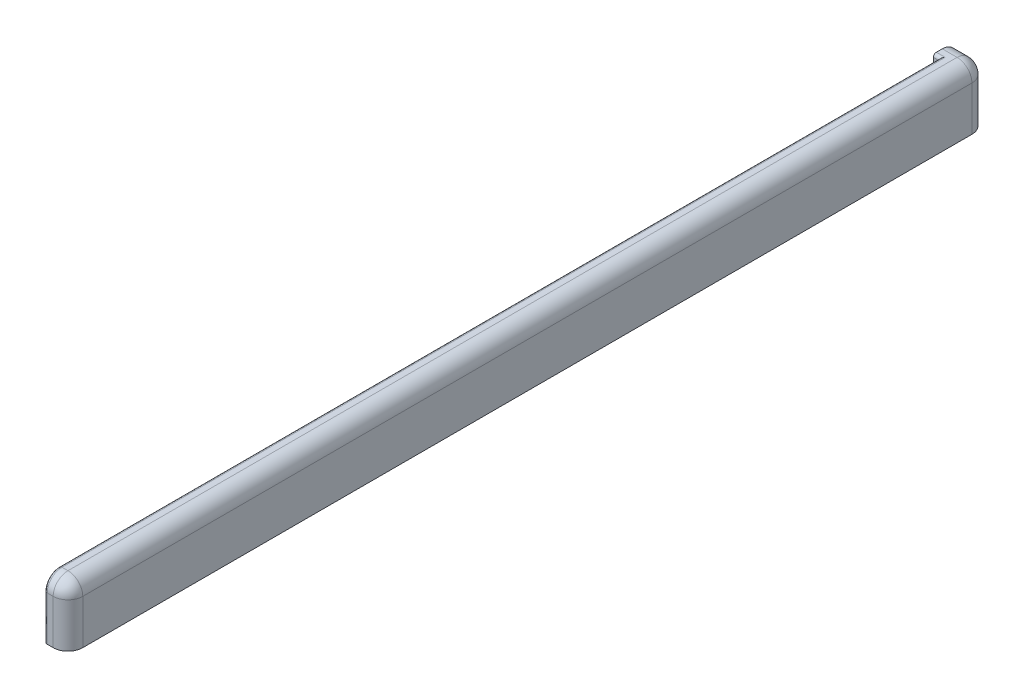
from build123d import *

# Parameters (mm, degrees)
SKETCH1_W                       = 39
SKETCH1_H                       = 155
BOSS_EXTRUDE1_DEPTH             = 2
BOSS_EXTRUDE2_DEPTH             = 38
SKETCH3_W                       = 2
SKETCH3_H                       = 2
BOSS_EXTRUDE3_DEPTH             = 38
SKETCH4_W                       = 2
SKETCH4_H                       = 2
BOSS_EXTRUDE4_DEPTH             = 151
SKETCH6_W                       = 35
SKETCH6_H                       = 2.2
CUT_EXTRUDE1_DEPTH              = 160.340045186
SKETCH7_W                       = 35
SKETCH7_H                       = 2.2
CUT_EXTRUDE2_DEPTH              = 89.490112442
SKETCH5_W                       = 31
SKETCH5_H                       = 2
BOSS_EXTRUDE5_DEPTH             = 2
BOSS_EXTRUDE6_REACH             = 91.367
SKETCH8_W                       = 2
SKETCH8_H                       = 2
BOSS_EXTRUDE6_DIRECTION_2_REACH = 91.367
SKETCH10_W                      = 2
SKETCH10_H                      = 2.2
SKETCH10_W_2                    = 2.2
SKETCH10_H_2                    = 2
BOSS_EXTRUDE8_DEPTH             = 2
SKETCH11_W                      = 2
SKETCH11_H                      = 2.2
SKETCH11_W_2                    = 2.2
SKETCH11_H_2                    = 2
BOSS_EXTRUDE9_DEPTH             = 2
FILLET2_R                       = 2.5
SKETCH14_W                      = 36.5
SKETCH14_H                      = 7.75
BOSS_EXTRUDE10_DEPTH            = 2
SKETCH13_W                      = 31
SKETCH13_H                      = 3
CUT_EXTRUDE4_DEPTH              = 2
FILLET3_R                       = 2
FILLET4_R                       = 0.5
SKETCH15_R                      = 5.1
CUT_EXTRUDE5_DEPTH              = 90.367219941
SKETCH16_R                      = 7.1
BOSS_EXTRUDE11_DEPTH            = 1
FILLET5_R                       = 0.5
CUT_EXTRUDE3_DEPTH              = 160.340045186
FILLET6_R                       = 0.4
FILLET7_R                       = 0.5
CUT_EXTRUDE6_DEPTH              = 6
SKETCH18_W                      = 29
SKETCH18_H                      = 3
CUT_EXTRUDE8_DEPTH              = 90.367220028
CUT_EXTRUDE11_DEPTH             = 90.367220028
CUT_EXTRUDE11_DEPTH_BACK        = 90.367220028
SKETCH20_W                      = 29
SKETCH20_H                      = 34
SKETCH21_W                      = 155
SKETCH21_H                      = 20
SKETCH21_H_2                    = 10
CUT_EXTRUDE12_DEPTH             = 90.367219941


with BuildPart() as part:
    # Sketch1 → Boss-Extrude1 (new body)
    with BuildSketch(Plane(origin=(0, 0, 0), x_dir=(1, 0, 0), z_dir=(0, 1, 0))):
        Rectangle(SKETCH1_W, SKETCH1_H)
    extrude(amount=BOSS_EXTRUDE1_DEPTH)

    # Sketch2 → Boss-Extrude2 (add)
    with BuildSketch(Plane(origin=(0, 2, 0), x_dir=(1, 0, 0), z_dir=(0, 1, 0))):
        Polygon((-17.5, -77.5), (-17.5, -75.5), (-17.5, 75.5), (17.5, 75.5), (17.5, -75.5), (17.5, -77.5), (19.5, -77.5), (19.5, 77.5), (-19.5, 77.5), (-19.5, -77.5), align=None)
    extrude(amount=BOSS_EXTRUDE2_DEPTH)

    # Sketch3 → Boss-Extrude3 (add)
    with BuildSketch(Plane(origin=(0, 2, 0), x_dir=(1, 0, 0), z_dir=(0, 1, 0))):
        with Locations((-16.5, -76.5)):
            Rectangle(SKETCH3_W, SKETCH3_H)
        with Locations((-16.5, -72.3)):
            Rectangle(SKETCH3_W, SKETCH3_H)
        with Locations((16.5, -76.5)):
            Rectangle(SKETCH3_W, SKETCH3_H)
        with Locations((16.5, -72.3)):
            Rectangle(SKETCH3_W, SKETCH3_H)
    extrude(amount=BOSS_EXTRUDE3_DEPTH)

    # Sketch4 → Boss-Extrude4 (add)
    with BuildSketch(Plane.XY.offset(-75.5)):
        with Locations((-16.5, 39)):
            Rectangle(SKETCH4_W, SKETCH4_H)
        Polygon((-15.5, 33.8), (-17.5, 31.8), (-17.5, 35.8), (-15.5, 35.8), align=None)
        Polygon((15.5, 35.8), (17.5, 35.8), (17.5, 31.8), (15.5, 33.8), align=None)
        with Locations((16.5, 39)):
            Rectangle(SKETCH4_W, SKETCH4_H)
    extrude(amount=BOSS_EXTRUDE4_DEPTH)

    # Sketch6 → Cut-Extrude1 (cut, through all)
    with BuildSketch(Plane.XY.offset(-75.5)):
        with Locations((0, 36.9)):
            Rectangle(SKETCH6_W, SKETCH6_H)
    extrude(amount=CUT_EXTRUDE1_DEPTH, mode=Mode.SUBTRACT)

    # Sketch7 → Cut-Extrude2 (cut, through all)
    with BuildSketch(Plane(origin=(0, 2, 0), x_dir=(1, 0, 0), z_dir=(0, 1, 0))):
        with Locations((0, -74.4)):
            Rectangle(SKETCH7_W, SKETCH7_H)
    extrude(amount=CUT_EXTRUDE2_DEPTH, mode=Mode.SUBTRACT)

    # Sketch5 → Boss-Extrude5 (add)
    with BuildSketch(Plane(origin=(0, 2, 0), x_dir=(1, 0, 0), z_dir=(0, 1, 0))):
        with Locations((0, -76.5)):
            Rectangle(SKETCH5_W, SKETCH5_H)
        with Locations((0, -72.3)):
            Rectangle(SKETCH5_W, SKETCH5_H)
    extrude(amount=BOSS_EXTRUDE5_DEPTH)

    # Boss-Extrude6: up to this face of the body (flat: up to its plane)
    boss_extrude6_end = Plane(part.part.faces().sort_by_distance((17.5, 16.9, -2.1))[0])
    # Sketch8 → Boss-Extrude6 (add, up to the picked face)
    with BuildSketch(Plane(origin=(0, 0, 0), x_dir=(0, 0, -1), z_dir=(1, 0, 0)), mode=Mode.PRIVATE) as boss_extrude6_sk1:
        with Locations((74.5, 39)):
            Rectangle(SKETCH8_W, SKETCH8_H)
    boss_extrude6_tool1 = split(extrude(boss_extrude6_sk1.sketch, amount=BOSS_EXTRUDE6_REACH, mode=Mode.PRIVATE), bisect_by=boss_extrude6_end, keep=Keep.BOTH, mode=Mode.PRIVATE)
    # Sketch8 → Boss-Extrude6 (add, up to the picked face)
    with BuildSketch(Plane(origin=(0, 0, 0), x_dir=(0, 0, -1), z_dir=(1, 0, 0)), mode=Mode.PRIVATE) as boss_extrude6_sk2:
        Polygon((75.5, 35.8), (73.5, 35.8), (73.5, 33.8), (75.5, 31.8), align=None)
    boss_extrude6_tool2 = split(extrude(boss_extrude6_sk2.sketch, amount=BOSS_EXTRUDE6_REACH, mode=Mode.PRIVATE), bisect_by=boss_extrude6_end, keep=Keep.BOTH, mode=Mode.PRIVATE)
    add(boss_extrude6_tool1.solids().sort_by(Axis((0, 39, -74.5), (1, 0, 0)))[0])
    add(boss_extrude6_tool2.solids().sort_by(Axis((0, 34.244444, -74.611111), (1, 0, 0)))[0])

    # Boss-Extrude6 direction 2: up to this face of the body (flat: up to its plane)
    boss_extrude6_direction_2_end = Plane(part.part.faces().sort_by_distance((-17.5, 16.9, -2.1))[0])
    # Sketch8 → Boss-Extrude6 direction 2 (add, up to the picked face)
    with BuildSketch(Plane(origin=(0, 0, 0), x_dir=(0, 0, -1), z_dir=(1, 0, 0)), mode=Mode.PRIVATE) as boss_extrude6_direction_2_sk1:
        with Locations((74.5, 39)):
            Rectangle(SKETCH8_W, SKETCH8_H)
    boss_extrude6_direction_2_tool1 = split(extrude(boss_extrude6_direction_2_sk1.sketch, amount=-BOSS_EXTRUDE6_DIRECTION_2_REACH, mode=Mode.PRIVATE), bisect_by=boss_extrude6_direction_2_end, keep=Keep.BOTH, mode=Mode.PRIVATE)
    # Sketch8 → Boss-Extrude6 direction 2 (add, up to the picked face)
    with BuildSketch(Plane(origin=(0, 0, 0), x_dir=(0, 0, -1), z_dir=(1, 0, 0)), mode=Mode.PRIVATE) as boss_extrude6_direction_2_sk2:
        Polygon((75.5, 35.8), (73.5, 35.8), (73.5, 33.8), (75.5, 31.8), align=None)
    boss_extrude6_direction_2_tool2 = split(extrude(boss_extrude6_direction_2_sk2.sketch, amount=-BOSS_EXTRUDE6_DIRECTION_2_REACH, mode=Mode.PRIVATE), bisect_by=boss_extrude6_direction_2_end, keep=Keep.BOTH, mode=Mode.PRIVATE)
    add(boss_extrude6_direction_2_tool1.solids().sort_by(Axis((0, 39, -74.5), (-1, 0, 0)))[0])
    add(boss_extrude6_direction_2_tool2.solids().sort_by(Axis((0, 34.244444, -74.611111), (-1, 0, 0)))[0])

    # Sketch10 → Boss-Extrude8 (add)
    with BuildSketch(Plane(origin=(-17.5, 0, 0), x_dir=(0, 0, -1), z_dir=(1, 0, 0))):
        with Locations((-76.5, 36.9)):
            Rectangle(SKETCH10_W, SKETCH10_H)
        with Locations((-74.4, 39)):
            Rectangle(SKETCH10_W_2, SKETCH10_H_2)
    extrude(amount=BOSS_EXTRUDE8_DEPTH)

    # Sketch11 → Boss-Extrude9 (add)
    with BuildSketch(Plane.ZY.offset(-17.5)):
        with Locations((76.5, 36.9)):
            Rectangle(SKETCH11_W, SKETCH11_H)
        with Locations((74.4, 39)):
            Rectangle(SKETCH11_W_2, SKETCH11_H_2)
    extrude(amount=BOSS_EXTRUDE9_DEPTH)

    # Fillet2
    fillet2_edges = [part.edges().sort_by_distance(p)[0] for p in [
        (-17.5, 16.9, 71.3),
        (17.5, 16.9, 71.3),
        (19.5, 20, 77.5),
        (-19.5, 20, 77.5),
        (-19.5, 20, -77.5),
        (-17.5, 16.9, -75.5),
        (17.5, 16.9, -75.5),
        (19.5, 20, -77.5),
        (19.5, 40, 0),
        (-19.5, 40, 0),
        (19.5, 0, 0),
        (-19.5, 0, 0),
        (0, 40, -77.5),
        (0, 0, 77.5),
        (0, 0, -77.5),
        (-17.5, 40, 77.5),
        (17.5, 40, 77.5),
    ]]
    fillet(fillet2_edges, radius=FILLET2_R)

    # Sketch14 → Boss-Extrude10 (add)
    with BuildSketch(Plane.XY.offset(-75.5)):
        with Locations((0, 5.125)):
            Rectangle(SKETCH14_W, SKETCH14_H)
    extrude(amount=BOSS_EXTRUDE10_DEPTH)

    # Sketch13 → Cut-Extrude4 (cut)
    with BuildSketch(Plane(origin=(0, 0, -77.5), x_dir=(-1, 0, 0), z_dir=(0, 0, -1))):
        with Locations((0, 5.5)):
            Rectangle(SKETCH13_W, SKETCH13_H)
    extrude(amount=-CUT_EXTRUDE4_DEPTH, mode=Mode.SUBTRACT)

    # Fillet3
    fillet3_edges = [part.edges().sort_by_distance(p)[0] for p in [
        (0, 9, -73.5),
    ]]
    fillet(fillet3_edges, radius=FILLET3_R - 0.0001)  # a hair under: the kernel refuses the full size

    # Fillet4
    fillet4_edges = [part.edges().sort_by_distance(p)[0] for p in [
        (15.5, 5.5, -75.5),
        (15.5, 4, -76.5),
        (0, 7, -75.5),
        (15.5, 7, -76.5),
        (-15.5, 5.5, -75.5),
        (-15.5, 7, -76.5),
        (0, 4, -75.5),
        (-15.5, 4, -76.5),
        (15.5, 5.5, -77.5),
        (0, 4, -77.5),
        (-15.5, 5.5, -77.5),
        (0, 7, -77.5),
    ]]
    fillet(fillet4_edges, radius=FILLET4_R)

    # Sketch15 → Cut-Extrude5 (cut, through all)
    with BuildSketch(Plane.XZ):
        with Locations(Location((0, 38.75, 0), (0, 0, 270))):
            Circle(SKETCH15_R)
        with Locations(Location((0, -38.75, 0), (0, 0, 270))):
            Circle(SKETCH15_R)
    extrude(amount=-CUT_EXTRUDE5_DEPTH, mode=Mode.SUBTRACT)

    # Sketch16 → Boss-Extrude11 (add)
    with BuildSketch(Plane(origin=(0, 2, 0), x_dir=(1, 0, 0), z_dir=(0, 1, 0))):
        with Locations(Location((0, 38.75, 0), (0, 0, 270))):
            Circle(SKETCH16_R)
        with Locations(Location((0, -38.75, 0), (0, 0, 270))):
            Circle(SKETCH16_R)
    extrude(amount=BOSS_EXTRUDE11_DEPTH)

    # Fillet5
    fillet5_edges = [part.edges().sort_by_distance(p)[0] for p in [
        (0, 2, -45.85),
        (0, 3, -45.85),
        (0, 2, 31.65),
        (0, 3, 31.65),
    ]]
    fillet(fillet5_edges, radius=FILLET5_R - 0.0001)  # a hair under: the kernel refuses the full size

    # Sketch12 → Cut-Extrude3 (cut, through all)
    with BuildSketch(Plane.XY.offset(-75.5)):
        with BuildLine():
            Line((1.668907005, 12.688040659), (2.22520934, 10.250720878))
            ThreePointArc((2.22520934, 10.250720878), (4.338837391, 10.990311321), (6.234898019, 12.181685175))
            Line((6.234898019, 12.181685175), (4.676173514, 14.136263881))
            ThreePointArc((4.676173514, 14.136263881), (3.254128043, 13.242733491), (1.668907005, 12.688040659))
        make_face()
        with BuildLine():
            ThreePointArc((-6.234898019, 12.181685175), (-4.338837391, 10.990311321), (-2.22520934, 10.250720878))
            Line((-2.22520934, 10.250720878), (-1.668907005, 12.688040659))
            ThreePointArc((-1.668907005, 12.688040659), (-3.254128043, 13.242733491), (-4.676173514, 14.136263881))
            Line((-4.676173514, 14.136263881), (-6.234898019, 12.181685175))
        make_face()
        with BuildLine():
            ThreePointArc((-10, 20), (-9.749279122, 17.77479066), (-9.009688679, 15.661162609))
            Line((-9.009688679, 15.661162609), (-6.757266509, 16.745871957))
            ThreePointArc((-6.757266509, 16.745871957), (-7.311959341, 18.331092995), (-7.5, 20))
            Line((-7.5, 20), (-10, 20))
        make_face()
        with BuildLine():
            ThreePointArc((-6.234898019, 27.818314825), (-7.818314825, 26.234898019), (-9.009688679, 24.338837391))
            Line((-9.009688679, 24.338837391), (-6.757266509, 23.254128043))
            ThreePointArc((-6.757266509, 23.254128043), (-5.863736119, 24.676173514), (-4.676173514, 25.863736119))
            Line((-4.676173514, 25.863736119), (-6.234898019, 27.818314825))
        make_face()
        with BuildLine():
            ThreePointArc((-1.668907005, 27.311959341), (-0.839733571, 27.452841574), (0, 27.5))
            Line((0, 27.5), (0, 30))
            ThreePointArc((0, 30), (-1.119644761, 29.937122099), (-2.22520934, 29.749279122))
            Line((-2.22520934, 29.749279122), (-1.668907005, 27.311959341))
        make_face()
        with BuildLine():
            Line((0, 30), (0, 27.5))
            ThreePointArc((0, 27.5), (0.839733571, 27.452841574), (1.668907005, 27.311959341))
            Line((1.668907005, 27.311959341), (2.22520934, 29.749279122))
            ThreePointArc((2.22520934, 29.749279122), (1.119644761, 29.937122099), (0, 30))
        make_face()
        with BuildLine():
            Line((6.757266509, 23.254128043), (9.009688679, 24.338837391))
            ThreePointArc((9.009688679, 24.338837391), (7.818314825, 26.234898019), (6.234898019, 27.818314825))
            Line((6.234898019, 27.818314825), (4.676173514, 25.863736119))
            ThreePointArc((4.676173514, 25.863736119), (5.863736119, 24.676173514), (6.757266509, 23.254128043))
        make_face()
        with BuildLine():
            Line((6.757266509, 16.745871957), (9.009688679, 15.661162609))
            ThreePointArc((9.009688679, 15.661162609), (9.749279122, 17.77479066), (10, 20))
            Line((10, 20), (7.5, 20))
            ThreePointArc((7.5, 20), (7.311959341, 18.331092995), (6.757266509, 16.745871957))
        make_face()
        with BuildLine():
            ThreePointArc((2.5, 20), (2.43731978, 19.443697665), (2.25242217, 18.915290652))
            Line((2.25242217, 18.915290652), (4.50484434, 17.830581304))
            ThreePointArc((4.50484434, 17.830581304), (4.874639561, 18.88739533), (5, 20))
            Line((5, 20), (2.5, 20))
        make_face()
        with BuildLine():
            ThreePointArc((1.558724505, 21.954578706), (1.954578706, 21.558724505), (2.25242217, 21.084709348))
            Line((2.25242217, 21.084709348), (4.50484434, 22.169418696))
            ThreePointArc((4.50484434, 22.169418696), (3.909157412, 23.117449009), (3.117449009, 23.909157412))
            Line((3.117449009, 23.909157412), (1.558724505, 21.954578706))
        make_face()
        with BuildLine():
            Line((0, 25), (0, 22.5))
            ThreePointArc((0, 22.5), (0.27991119, 22.484280525), (0.556302335, 22.43731978))
            Line((0.556302335, 22.43731978), (1.11260467, 24.874639561))
            ThreePointArc((1.11260467, 24.874639561), (0.559822381, 24.968561049), (0, 25))
        make_face()
        with BuildLine():
            ThreePointArc((-0.556302335, 22.43731978), (-0.27991119, 22.484280525), (0, 22.5))
            Line((0, 22.5), (0, 25))
            ThreePointArc((0, 25), (-0.559822381, 24.968561049), (-1.11260467, 24.874639561))
            Line((-1.11260467, 24.874639561), (-0.556302335, 22.43731978))
        make_face()
        with BuildLine():
            ThreePointArc((-2.25242217, 21.084709348), (-1.954578706, 21.558724505), (-1.558724505, 21.954578706))
            Line((-1.558724505, 21.954578706), (-3.117449009, 23.909157412))
            ThreePointArc((-3.117449009, 23.909157412), (-3.909157412, 23.117449009), (-4.50484434, 22.169418696))
            Line((-4.50484434, 22.169418696), (-2.25242217, 21.084709348))
        make_face()
        with BuildLine():
            ThreePointArc((-2.25242217, 18.915290652), (-2.43731978, 19.443697665), (-2.5, 20))
            Line((-2.5, 20), (-5, 20))
            ThreePointArc((-5, 20), (-4.874639561, 18.88739533), (-4.50484434, 17.830581304))
            Line((-4.50484434, 17.830581304), (-2.25242217, 18.915290652))
        make_face()
        with BuildLine():
            ThreePointArc((-3.117449009, 16.090842588), (-2.169418696, 15.49515566), (-1.11260467, 15.125360439))
            Line((-1.11260467, 15.125360439), (-0.556302335, 17.56268022))
            ThreePointArc((-0.556302335, 17.56268022), (-1.084709348, 17.74757783), (-1.558724505, 18.045421294))
            Line((-1.558724505, 18.045421294), (-3.117449009, 16.090842588))
        make_face()
        with BuildLine():
            Line((0.556302335, 17.56268022), (1.11260467, 15.125360439))
            ThreePointArc((1.11260467, 15.125360439), (2.169418696, 15.49515566), (3.117449009, 16.090842588))
            Line((3.117449009, 16.090842588), (1.558724505, 18.045421294))
            ThreePointArc((1.558724505, 18.045421294), (1.084709348, 17.74757783), (0.556302335, 17.56268022))
        make_face()
    extrude(amount=-CUT_EXTRUDE3_DEPTH, mode=Mode.SUBTRACT)

    # Fillet6
    fillet6_edges = [part.edges().sort_by_distance(p)[0] for p in [
        (5.863736119, 24.676173514, -75.5),
        (5.455535766, 26.841025472, -75.5),
        (7.818314825, 26.234898019, -77.5),
        (7.883477594, 23.796482717, -77.5),
        (5.863736119, 24.676173514, -77.5),
        (5.455535766, 26.841025472, -77.5),
        (7.883477594, 23.796482717, -75.5),
        (7.818314825, 26.234898019, -75.5),
        (7.311959341, 18.331092995, -75.5),
        (8.75, 20, -75.5),
        (9.749279122, 17.77479066, -77.5),
        (7.883477594, 16.203517283, -77.5),
        (7.311959341, 18.331092995, -77.5),
        (8.75, 20, -77.5),
        (7.883477594, 16.203517283, -75.5),
        (9.749279122, 17.77479066, -75.5),
        (2.43731978, 19.443697665, -75.5),
        (3.75, 20, -75.5),
        (4.874639561, 18.88739533, -77.5),
        (3.378633255, 18.372935978, -77.5),
        (2.43731978, 19.443697665, -77.5),
        (3.75, 20, -77.5),
        (3.378633255, 18.372935978, -75.5),
        (4.874639561, 18.88739533, -75.5),
        (1.954578706, 21.558724505, -75.5),
        (2.338086757, 22.931868059, -75.5),
        (3.909157412, 23.117449009, -77.5),
        (3.378633255, 21.627064022, -77.5),
        (1.954578706, 21.558724505, -77.5),
        (2.338086757, 22.931868059, -77.5),
        (3.378633255, 21.627064022, -75.5),
        (3.909157412, 23.117449009, -75.5),
        (0, 27.5, -75.5),
        (-1.947058172, 28.530619232, -75.5),
        (0, 30, -77.5),
        (1.947058172, 28.530619232, -77.5),
        (0, 27.5, -77.5),
        (-1.947058172, 28.530619232, -77.5),
        (1.947058172, 28.530619232, -75.5),
        (0, 30, -75.5),
        (-5.863736119, 24.676173514, -75.5),
        (-7.883477594, 23.796482717, -75.5),
        (-7.818314825, 26.234898019, -77.5),
        (-5.455535766, 26.841025472, -77.5),
        (-5.863736119, 24.676173514, -77.5),
        (-7.883477594, 23.796482717, -77.5),
        (-5.455535766, 26.841025472, -75.5),
        (-7.818314825, 26.234898019, -75.5),
        (-7.311959341, 18.331092995, -75.5),
        (-7.883477594, 16.203517283, -75.5),
        (-9.749279122, 17.77479066, -77.5),
        (-8.75, 20, -77.5),
        (-7.311959341, 18.331092995, -77.5),
        (-7.883477594, 16.203517283, -77.5),
        (-8.75, 20, -75.5),
        (-9.749279122, 17.77479066, -75.5),
        (-3.254128043, 13.242733491, -75.5),
        (-1.947058172, 11.469380768, -75.5),
        (-4.338837391, 10.990311321, -77.5),
        (-5.455535766, 13.158974528, -77.5),
        (-3.254128043, 13.242733491, -77.5),
        (-1.947058172, 11.469380768, -77.5),
        (-5.455535766, 13.158974528, -75.5),
        (-4.338837391, 10.990311321, -75.5),
        (1.084709348, 17.74757783, -75.5),
        (2.338086757, 17.068131941, -75.5),
        (2.169418696, 15.49515566, -77.5),
        (0.834453502, 16.344020329, -77.5),
        (1.084709348, 17.74757783, -77.5),
        (2.338086757, 17.068131941, -77.5),
        (0.834453502, 16.344020329, -75.5),
        (2.169418696, 15.49515566, -75.5),
        (-2.43731978, 19.443697665, -75.5),
        (-3.378633255, 18.372935978, -75.5),
        (-4.874639561, 18.88739533, -77.5),
        (-3.75, 20, -77.5),
        (-2.43731978, 19.443697665, -77.5),
        (-3.378633255, 18.372935978, -77.5),
        (-3.75, 20, -75.5),
        (-4.874639561, 18.88739533, -75.5),
        (-1.084709348, 17.74757783, -75.5),
        (-0.834453502, 16.344020329, -75.5),
        (-2.169418696, 15.49515566, -77.5),
        (-2.338086757, 17.068131941, -77.5),
        (-1.084709348, 17.74757783, -77.5),
        (-0.834453502, 16.344020329, -77.5),
        (-2.338086757, 17.068131941, -75.5),
        (-2.169418696, 15.49515566, -75.5),
        (-1.954578706, 21.558724505, -75.5),
        (-3.378633255, 21.627064022, -75.5),
        (-3.909157412, 23.117449009, -77.5),
        (-2.338086757, 22.931868059, -77.5),
        (-1.954578706, 21.558724505, -77.5),
        (-3.378633255, 21.627064022, -77.5),
        (-2.338086757, 22.931868059, -75.5),
        (-3.909157412, 23.117449009, -75.5),
        (0, 25, -77.5),
        (0.834453502, 23.655979671, -77.5),
        (0, 22.5, -75.5),
        (-0.834453502, 23.655979671, -75.5),
        (0, 22.5, -77.5),
        (-0.834453502, 23.655979671, -77.5),
        (0, 25, -75.5),
        (0.834453502, 23.655979671, -75.5),
        (3.254128043, 13.242733491, -75.5),
        (5.455535766, 13.158974528, -75.5),
        (4.338837391, 10.990311321, -77.5),
        (1.947058172, 11.469380768, -77.5),
        (3.254128043, 13.242733491, -77.5),
        (5.455535766, 13.158974528, -77.5),
        (1.947058172, 11.469380768, -75.5),
        (4.338837391, 10.990311321, -75.5),
    ]]
    fillet(fillet6_edges, radius=FILLET6_R)

    # Fillet7
    fillet7_edges = [part.edges().sort_by_distance(p)[0] for p in [
        (15.5, 40, 0.75),
        (0, 4, 77.5),
        (0, 40, -73.5),
        (-15.5, 40, 0.75),
        (-15.5, 20.75, 77.5),
        (-15.5, 39.267766953, 76.767766953),
        (15.5, 20.75, 77.5),
        (15.5, 39.267766953, 76.767766953),
    ]]
    fillet(fillet7_edges, radius=FILLET7_R)

    # Sketch17 → Cut-Extrude6 (cut)
    with BuildSketch(Plane.XZ):
        Polygon((-17, -77.5), (-17, 70.299999999), (-14.999999999, 71.3), (-14.999999999, 77.5), (14.999999999, 77.5), (14.999999999, 71.3), (17, 70.299999999), (17, -77.5), align=None)
    extrude(amount=-CUT_EXTRUDE6_DEPTH, mode=Mode.SUBTRACT)

    # Sketch18 → Cut-Extrude8 (cut, through all)
    with BuildSketch(Plane.XY):
        with Locations((0, 7.5)):
            Rectangle(SKETCH18_W, SKETCH18_H)
    extrude(amount=-CUT_EXTRUDE8_DEPTH, mode=Mode.SUBTRACT)

    # Sketch20 → Cut-Extrude11 (cut, two sides: drawn at the far end of the back side and taken through both)
    with BuildSketch(Plane.XY.offset(-CUT_EXTRUDE11_DEPTH_BACK)):
        with Locations((0, 23)):
            Rectangle(SKETCH20_W, SKETCH20_H)
    extrude(amount=CUT_EXTRUDE11_DEPTH + CUT_EXTRUDE11_DEPTH_BACK, mode=Mode.SUBTRACT)


with BuildPart() as body_2:
    # of the pieces the cut leaves, the one that is kept (cut_extrude11_keep)
    add(part.part.solids().sort_by_distance((14.5, 40, -75))[0])

    # Sketch21 → Cut-Extrude12 (cut, through all)
    with BuildSketch(Plane(origin=(0, 0, 0), x_dir=(0, 0, -1), z_dir=(1, 0, 0))):
        with Locations((0, 20)):
            Rectangle(SKETCH21_W, SKETCH21_H)
        with Locations((0, 5)):
            Rectangle(SKETCH21_W, SKETCH21_H_2)
    extrude(amount=CUT_EXTRUDE12_DEPTH, mode=Mode.SUBTRACT)


solid = body_2.part
